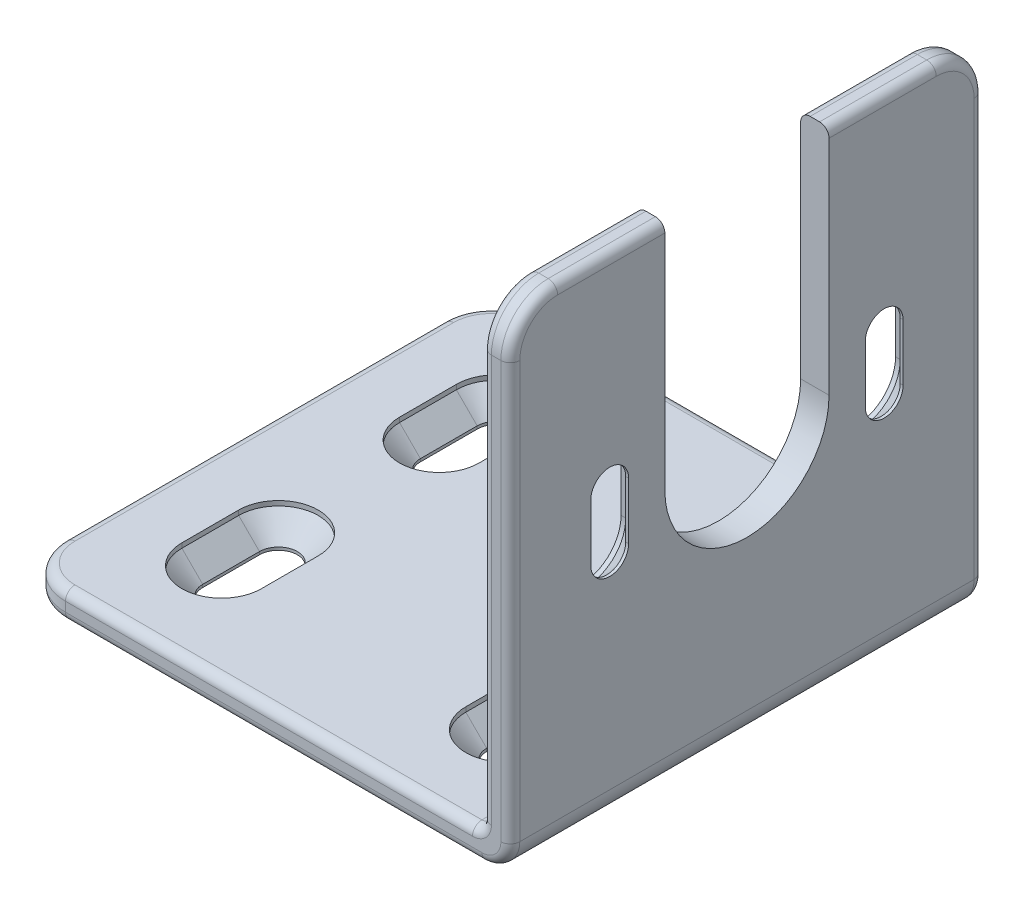
from build123d import *

# Parameters (mm, degrees)
BOSS_EXTRUDE1_DEPTH           = 3
BOSS_EXTRUDE3_DEPTH           = 3
FILLET2_R                     = 3
FILLET4_R                     = 1
FILLET5_R                     = 1
CUT_EXTRUDE4_DEPTH            = 0.5
CUT_EXTRUDE8_DEPTH            = 0.5
CUT_EXTRUDE12_DEPTH           = 2.192314
CUT_EXTRUDE12_DRAFT           = 45
CUT_EXTRUDE12_PROFILE_2_DEPTH = 2.192314
CUT_EXTRUDE12_PROFILE_2_DRAFT = 45


with BuildPart() as part:
    # Sketch1 → Boss-Extrude1 (new body)
    with BuildSketch(Plane(origin=(0, 0, 0), x_dir=(1, 0, 0), z_dir=(0, 1, 0))):
        with BuildLine():
            Line((-21, -25), (26, -25))
            Line((26, -25), (26, 25))
            Line((26, 25), (-21, 25))
            ThreePointArc((-21, 25), (-24.535533906, 23.535533906), (-26, 20))
            Line((-26, 20), (-26, -20))
            ThreePointArc((-26, -20), (-24.535533906, -23.535533906), (-21, -25))
        make_face()
        with BuildLine():
            Line((-13, 14.5), (-13, 8.5))
            ThreePointArc((-13, 8.5), (-15, 6.5), (-17, 8.5))
            Line((-17, 8.5), (-17, 14.5))
            ThreePointArc((-17, 14.5), (-15, 16.5), (-13, 14.5))
        make_face(mode=Mode.SUBTRACT)
        with BuildLine():
            Line((13, 14.5), (13, 8.5))
            ThreePointArc((13, 8.5), (15, 6.5), (17, 8.5))
            Line((17, 8.5), (17, 14.5))
            ThreePointArc((17, 14.5), (15, 16.5), (13, 14.5))
        make_face(mode=Mode.SUBTRACT)
        with BuildLine():
            Line((13, -14.5), (13, -8.5))
            ThreePointArc((13, -8.5), (15, -6.5), (17, -8.5))
            Line((17, -8.5), (17, -14.5))
            ThreePointArc((17, -14.5), (15, -16.5), (13, -14.5))
        make_face(mode=Mode.SUBTRACT)
        with BuildLine():
            Line((-13, -14.5), (-13, -8.5))
            ThreePointArc((-13, -8.5), (-15, -6.5), (-17, -8.5))
            Line((-17, -8.5), (-17, -14.5))
            ThreePointArc((-17, -14.5), (-15, -16.5), (-13, -14.5))
        make_face(mode=Mode.SUBTRACT)
    extrude(amount=BOSS_EXTRUDE1_DEPTH)

    # Sketch2 → Boss-Extrude3 (add)
    with BuildSketch(Plane(origin=(26, 0, 0), x_dir=(0, 0, -1), z_dir=(1, 0, 0))):
        with BuildLine():
            Line((25, 3), (-25, 3))
            Line((-25, 3), (-25, 47.03))
            ThreePointArc((-25, 47.03), (-23.535533906, 50.565533906), (-20, 52.03))
            Line((-20, 52.03), (-8.675, 52.03))
            Line((-8.675, 52.03), (-8.675, 27.515))
            ThreePointArc((-8.675, 27.515), (0, 18.84), (8.675, 27.515))
            Line((8.675, 27.515), (8.675, 52.03))
            Line((8.675, 52.03), (20, 52.03))
            ThreePointArc((20, 52.03), (23.535533906, 50.565533906), (25, 47.03))
            Line((25, 47.03), (25, 3))
        make_face()
        with BuildLine():
            Line((-16.5, 24.515), (-16.5, 30.515))
            ThreePointArc((-16.5, 30.515), (-14.5, 32.515), (-12.5, 30.515))
            Line((-12.5, 30.515), (-12.5, 24.515))
            ThreePointArc((-12.5, 24.515), (-14.5, 22.515), (-16.5, 24.515))
        make_face(mode=Mode.SUBTRACT)
        with BuildLine():
            Line((16.5, 30.515), (16.5, 24.515))
            ThreePointArc((16.5, 24.515), (14.5, 22.515), (12.5, 24.515))
            Line((12.5, 24.515), (12.5, 30.515))
            ThreePointArc((12.5, 30.515), (14.5, 32.515), (16.5, 30.515))
        make_face(mode=Mode.SUBTRACT)
    extrude(amount=-BOSS_EXTRUDE3_DEPTH)

    # Fillet2
    fillet2_edges = [part.edges().sort_by_distance(p)[0] for p in [
        (26, 0, 0),
    ]]
    fillet(fillet2_edges, radius=FILLET2_R)

    # Fillet4
    fillet4_edges = [part.edges().sort_by_distance(p)[0] for p in [
        (23, 3, 0),
    ]]
    fillet(fillet4_edges, radius=FILLET4_R)

    # Fillet5
    fillet5_edges = [part.edges().sort_by_distance(p)[0] for p in [
        (-24.535533906, 3, -23.535533906),
        (26, 25.015, 25),
        (26, 25.015, -25),
        (1, 0, -25),
        (25.121320344, 0.878679656, -25),
        (25.121320344, 0.878679656, 25),
        (0.5, 3, -25),
        (23, 25.515, -25),
        (22.707106781, 3.292893219, -25),
        (22.707106781, 3.292893219, 25),
        (-26, 3, 0),
        (-24.535533906, 3, 23.535533906),
        (0.5, 3, 25),
        (1, 0, 25),
        (-24.535533906, 0, 23.535533906),
        (-26, 0, 0),
        (-24.535533906, 0, -23.535533906),
        (23, 25.515, 25),
        (23, 50.565533906, 23.535533906),
        (23, 52.03, 14.3375),
        (23, 52.03, -14.3375),
        (23, 50.565533906, -23.535533906),
        (26, 50.565533906, -23.535533906),
        (26, 52.03, -14.3375),
        (26, 52.03, 14.3375),
        (26, 50.565533906, 23.535533906),
    ]]
    fillet(fillet5_edges, radius=FILLET5_R)

    # Sketch5 → Cut-Extrude4 (cut)
    with BuildSketch(Plane(origin=(0, 3, 0), x_dir=(1, 0, 0), z_dir=(0, 1, 0))):
        with BuildLine():
            Line((-19.2, 8.5), (-19.2, 14.5))
            ThreePointArc((-19.2, 14.5), (-15, 18.7), (-10.8, 14.5))
            Line((-10.8, 14.5), (-10.8, 8.5))
            ThreePointArc((-10.8, 8.5), (-15, 4.3), (-19.2, 8.5))
        make_face()
        with BuildLine():
            Line((19.2, 8.5), (19.2, 14.5))
            ThreePointArc((19.2, 14.5), (15, 18.7), (10.8, 14.5))
            Line((10.8, 14.5), (10.8, 8.5))
            ThreePointArc((10.8, 8.5), (15, 4.3), (19.2, 8.5))
        make_face()
        with BuildLine():
            Line((-19.2, -8.5), (-19.2, -14.5))
            ThreePointArc((-19.2, -14.5), (-15, -18.7), (-10.8, -14.5))
            Line((-10.8, -14.5), (-10.8, -8.5))
            ThreePointArc((-10.8, -8.5), (-15, -4.3), (-19.2, -8.5))
        make_face()
        with BuildLine():
            Line((19.2, -8.5), (19.2, -14.5))
            ThreePointArc((19.2, -14.5), (15, -18.7), (10.8, -14.5))
            Line((10.8, -14.5), (10.8, -8.5))
            ThreePointArc((10.8, -8.5), (15, -4.3), (19.2, -8.5))
        make_face()
    extrude(amount=-CUT_EXTRUDE4_DEPTH, mode=Mode.SUBTRACT)

    # Sketch6 → Cut-Extrude8 (cut)
    with BuildSketch(Plane.ZY.offset(-23)):
        with BuildLine():
            Line((-10.3, 30.515), (-10.3, 24.515))
            ThreePointArc((-10.3, 24.515), (-14.5, 20.315), (-18.7, 24.515))
            Line((-18.7, 24.515), (-18.7, 30.515))
            ThreePointArc((-18.7, 30.515), (-14.5, 34.715), (-10.3, 30.515))
        make_face()
        with BuildLine():
            Line((10.3, 30.515), (10.3, 24.515))
            ThreePointArc((10.3, 24.515), (14.5, 20.315), (18.7, 24.515))
            Line((18.7, 24.515), (18.7, 30.515))
            ThreePointArc((18.7, 30.515), (14.5, 34.715), (10.3, 30.515))
        make_face()
    extrude(amount=-CUT_EXTRUDE8_DEPTH, mode=Mode.SUBTRACT)

    # Cut-Extrude11: read off the stored shape, not the designer's step
    # Cut-Extrude11: loft between two sections, ruled curve by curve
    cut_extrude11_from = [
        Edge.make_three_point_arc((-13, 0.3, -14.5), (-13.585786438, 0.3, -15.914213562), (-15, 0.3, -16.5)),
        Edge.make_three_point_arc((-15, 0.3, -16.5), (-16.414213562, 0.3, -15.914213562), (-17, 0.3, -14.5)),
        Edge.make_three_point_arc((-17, 0.3, -8.5), (-16.414213562, 0.3, -7.085786438), (-15, 0.3, -6.5)),
        Edge.make_three_point_arc((-15, 0.3, -6.5), (-13.585786438, 0.3, -7.085786438), (-13, 0.3, -8.5)),
        Edge.make_line((-17, 0.3, -14.5), (-17, 0.3, -8.5)),
        Edge.make_line((-13, 0.3, -8.5), (-13, 0.3, -14.5)),
    ]
    cut_extrude11_to = [
        Edge.make_three_point_arc((-10.8, 2.5, -14.5), (-12.030151519, 2.5, -17.469848481), (-15, 2.5, -18.7)),
        Edge.make_three_point_arc((-15, 2.5, -18.7), (-17.969848481, 2.5, -17.469848481), (-19.2, 2.5, -14.5)),
        Edge.make_three_point_arc((-19.2, 2.5, -8.5), (-17.969848481, 2.5, -5.530151519), (-15, 2.5, -4.3)),
        Edge.make_three_point_arc((-15, 2.5, -4.3), (-12.030151519, 2.5, -5.530151519), (-10.8, 2.5, -8.5)),
        Edge.make_line((-19.2, 2.5, -14.5), (-19.2, 2.5, -8.5)),
        Edge.make_line((-10.8, 2.5, -8.5), (-10.8, 2.5, -14.5)),
    ]
    cut_extrude11 = Solid(Shell([*[Face.make_surface_from_curves(cut_extrude11_from[k], cut_extrude11_to[k]) for k in range(6)], Face(Wire(cut_extrude11_from)), Face(Wire(cut_extrude11_to))]))
    add(cut_extrude11, mode=Mode.SUBTRACT)

    # Cut-Extrude11 2: loft between two sections, ruled curve by curve
    cut_extrude11_2_from = [
        Edge.make_three_point_arc((-17, 0.3, 14.5), (-16.414213562, 0.3, 15.914213562), (-15, 0.3, 16.5)),
        Edge.make_three_point_arc((-15, 0.3, 16.5), (-13.585786438, 0.3, 15.914213562), (-13, 0.3, 14.5)),
        Edge.make_three_point_arc((-13, 0.3, 8.5), (-13.585786438, 0.3, 7.085786438), (-15, 0.3, 6.5)),
        Edge.make_three_point_arc((-15, 0.3, 6.5), (-16.414213562, 0.3, 7.085786438), (-17, 0.3, 8.5)),
        Edge.make_line((-17, 0.3, 8.5), (-17, 0.3, 14.5)),
        Edge.make_line((-13, 0.3, 14.5), (-13, 0.3, 8.5)),
    ]
    cut_extrude11_2_to = [
        Edge.make_three_point_arc((-19.2, 2.5, 14.5), (-17.969848481, 2.5, 17.469848481), (-15, 2.5, 18.7)),
        Edge.make_three_point_arc((-15, 2.5, 18.7), (-12.030151519, 2.5, 17.469848481), (-10.8, 2.5, 14.5)),
        Edge.make_three_point_arc((-10.8, 2.5, 8.5), (-12.030151519, 2.5, 5.530151519), (-15, 2.5, 4.3)),
        Edge.make_three_point_arc((-15, 2.5, 4.3), (-17.969848481, 2.5, 5.530151519), (-19.2, 2.5, 8.5)),
        Edge.make_line((-19.2, 2.5, 8.5), (-19.2, 2.5, 14.5)),
        Edge.make_line((-10.8, 2.5, 14.5), (-10.8, 2.5, 8.5)),
    ]
    cut_extrude11_2 = Solid(Shell([*[Face.make_surface_from_curves(cut_extrude11_2_from[k], cut_extrude11_2_to[k]) for k in range(6)], Face(Wire(cut_extrude11_2_from)), Face(Wire(cut_extrude11_2_to))]))
    add(cut_extrude11_2, mode=Mode.SUBTRACT)

    # Cut-Extrude11 3: loft between two sections, ruled curve by curve
    cut_extrude11_3_from = [
        Edge.make_three_point_arc((17, 0.3, -14.5), (16.414213562, 0.3, -15.914213562), (15, 0.3, -16.5)),
        Edge.make_three_point_arc((15, 0.3, -16.5), (13.585786438, 0.3, -15.914213562), (13, 0.3, -14.5)),
        Edge.make_three_point_arc((13, 0.3, -8.5), (13.585786438, 0.3, -7.085786438), (15, 0.3, -6.5)),
        Edge.make_three_point_arc((15, 0.3, -6.5), (16.414213562, 0.3, -7.085786438), (17, 0.3, -8.5)),
        Edge.make_line((13, 0.3, -14.5), (13, 0.3, -8.5)),
        Edge.make_line((17, 0.3, -8.5), (17, 0.3, -14.5)),
    ]
    cut_extrude11_3_to = [
        Edge.make_three_point_arc((19.2, 2.5, -14.5), (17.969848481, 2.5, -17.469848481), (15, 2.5, -18.7)),
        Edge.make_three_point_arc((15, 2.5, -18.7), (12.030151519, 2.5, -17.469848481), (10.8, 2.5, -14.5)),
        Edge.make_three_point_arc((10.8, 2.5, -8.5), (12.030151519, 2.5, -5.530151519), (15, 2.5, -4.3)),
        Edge.make_three_point_arc((15, 2.5, -4.3), (17.969848481, 2.5, -5.530151519), (19.2, 2.5, -8.5)),
        Edge.make_line((10.8, 2.5, -14.5), (10.8, 2.5, -8.5)),
        Edge.make_line((19.2, 2.5, -8.5), (19.2, 2.5, -14.5)),
    ]
    cut_extrude11_3 = Solid(Shell([*[Face.make_surface_from_curves(cut_extrude11_3_from[k], cut_extrude11_3_to[k]) for k in range(6)], Face(Wire(cut_extrude11_3_from)), Face(Wire(cut_extrude11_3_to))]))
    add(cut_extrude11_3, mode=Mode.SUBTRACT)

    # Cut-Extrude11 4: loft between two sections, ruled curve by curve
    cut_extrude11_4_from = [
        Edge.make_three_point_arc((13, 0.3, 14.5), (13.585786438, 0.3, 15.914213562), (15, 0.3, 16.5)),
        Edge.make_three_point_arc((15, 0.3, 16.5), (16.414213562, 0.3, 15.914213562), (17, 0.3, 14.5)),
        Edge.make_three_point_arc((17, 0.3, 8.5), (16.414213562, 0.3, 7.085786438), (15, 0.3, 6.5)),
        Edge.make_three_point_arc((15, 0.3, 6.5), (13.585786438, 0.3, 7.085786438), (13, 0.3, 8.5)),
        Edge.make_line((13, 0.3, 8.5), (13, 0.3, 14.5)),
        Edge.make_line((17, 0.3, 14.5), (17, 0.3, 8.5)),
    ]
    cut_extrude11_4_to = [
        Edge.make_three_point_arc((10.8, 2.5, 14.5), (12.030151519, 2.5, 17.469848481), (15, 2.5, 18.7)),
        Edge.make_three_point_arc((15, 2.5, 18.7), (17.969848481, 2.5, 17.469848481), (19.2, 2.5, 14.5)),
        Edge.make_three_point_arc((19.2, 2.5, 8.5), (17.969848481, 2.5, 5.530151519), (15, 2.5, 4.3)),
        Edge.make_three_point_arc((15, 2.5, 4.3), (12.030151519, 2.5, 5.530151519), (10.8, 2.5, 8.5)),
        Edge.make_line((10.8, 2.5, 8.5), (10.8, 2.5, 14.5)),
        Edge.make_line((19.2, 2.5, 14.5), (19.2, 2.5, 8.5)),
    ]
    cut_extrude11_4 = Solid(Shell([*[Face.make_surface_from_curves(cut_extrude11_4_from[k], cut_extrude11_4_to[k]) for k in range(6)], Face(Wire(cut_extrude11_4_from)), Face(Wire(cut_extrude11_4_to))]))
    add(cut_extrude11_4, mode=Mode.SUBTRACT)


with BuildPart() as cut_extrude12_tool:
    # Sketch16 → Cut-Extrude12 (with draft: the straight prism first)
    with BuildSketch(Plane(origin=(25.692313855, 0, 0), x_dir=(0, 0, -1), z_dir=(1, 0, 0))):
        with BuildLine():
            ThreePointArc((16.5, 30.515), (14.5, 32.515), (12.5, 30.515))
            Line((12.5, 30.515), (12.5, 24.515))
            ThreePointArc((12.5, 24.515), (14.5, 22.515), (16.5, 24.515))
            Line((16.5, 24.515), (16.5, 30.515))
        make_face()
    extrude(amount=-CUT_EXTRUDE12_DEPTH)
    # Cut-Extrude12: the draft: its side faces are tilted about the plane it starts from
    cut_extrude12_sides = [cut_extrude12_tool.faces().sort_by_distance(p)[0] for p in [
        (24.596156855, 32.515, -14.5),
        (24.596156855, 27.515, -12.5),
        (24.596156855, 22.515, -14.5),
        (24.596156855, 27.515, -16.5),
    ]]
    draft(cut_extrude12_sides, Plane(origin=(25.692313855, 0, 0), x_dir=(0, 0, -1), z_dir=(1, 0, 0)), CUT_EXTRUDE12_DRAFT)


with BuildPart() as part_1:
    add(part.part)

    # Cut-Extrude12: cut by cut_extrude12_tool
    add(cut_extrude12_tool.part, mode=Mode.SUBTRACT)


with BuildPart() as cut_extrude12_profile_2_tool:
    # Sketch16 → Cut-Extrude12 profile 2 (with draft: the straight prism first)
    with BuildSketch(Plane(origin=(25.692313855, 0, 0), x_dir=(0, 0, -1), z_dir=(1, 0, 0))):
        with BuildLine():
            ThreePointArc((-12.5, 30.515), (-14.5, 32.515), (-16.5, 30.515))
            Line((-16.5, 30.515), (-16.5, 24.515))
            ThreePointArc((-16.5, 24.515), (-14.5, 22.515), (-12.5, 24.515))
            Line((-12.5, 24.515), (-12.5, 30.515))
        make_face()
    extrude(amount=-CUT_EXTRUDE12_PROFILE_2_DEPTH)
    # Cut-Extrude12 profile 2: the draft: its side faces are tilted about the plane it starts from
    cut_extrude12_profile_2_sides = [cut_extrude12_profile_2_tool.faces().sort_by_distance(p)[0] for p in [
        (24.596156855, 32.515, 14.5),
        (24.596156855, 27.515, 16.5),
        (24.596156855, 22.515, 14.5),
        (24.596156855, 27.515, 12.5),
    ]]
    draft(cut_extrude12_profile_2_sides, Plane(origin=(25.692313855, 0, 0), x_dir=(0, 0, -1), z_dir=(1, 0, 0)), CUT_EXTRUDE12_PROFILE_2_DRAFT)


with BuildPart() as part_2:
    add(part_1.part)

    # Cut-Extrude12 profile 2: cut by cut_extrude12_profile_2_tool
    add(cut_extrude12_profile_2_tool.part, mode=Mode.SUBTRACT)


solid = part_2.part
